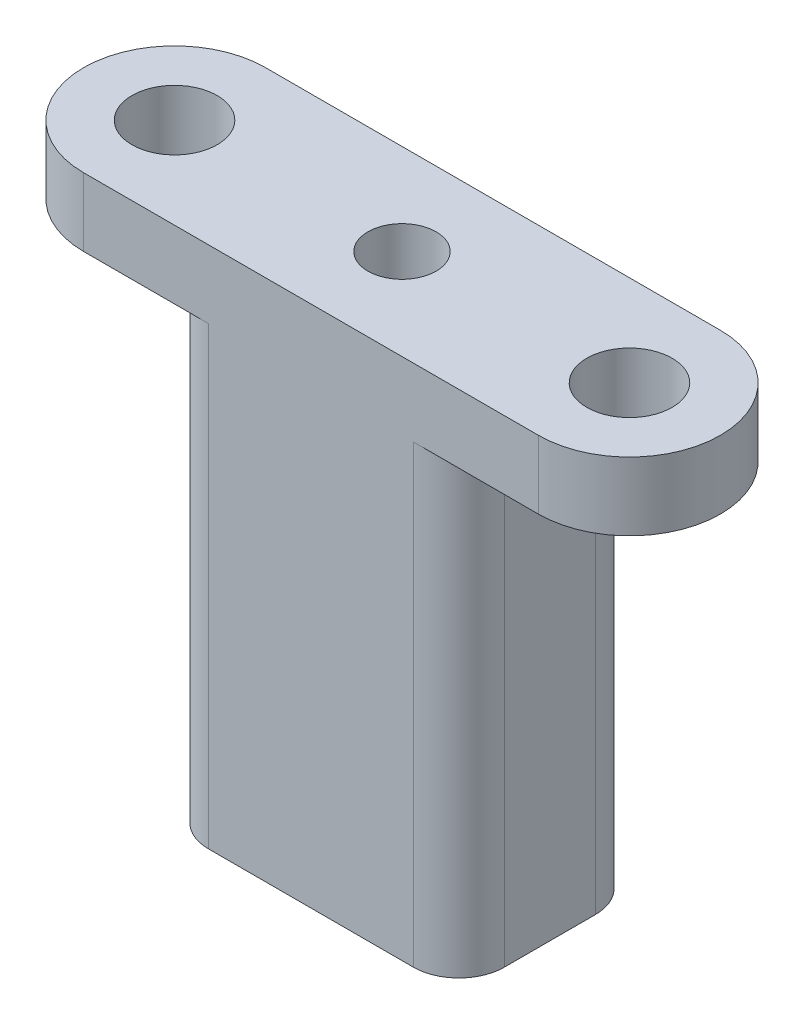
from build123d import *

# Parameters (mm, degrees)
SKETCH1_R           = 1.875
SKETCH1_R_2         = 1.5
BOSS_EXTRUDE1_DEPTH = 3
BOSS_EXTRUDE2_START = 20
SKETCH3_W           = 13
SKETCH3_H           = 8
SKETCH3_R           = 1.5
BOSS_EXTRUDE2_DEPTH = 20
FILLET1_R           = 2


with BuildPart() as part:
    # Sketch1 → Boss-Extrude1 (new body)
    with BuildSketch(Plane(origin=(0, 0, 0), x_dir=(1, 0, 0), z_dir=(0, 1, 0))):
        with BuildLine():
            Line((-10, -4), (10, -4))
            ThreePointArc((10, -4), (14, 0), (10, 4))
            Line((10, 4), (-10, 4))
            ThreePointArc((-10, 4), (-14, 0), (-10, -4))
        make_face()
        with Locations((-10, 0)):
            Circle(SKETCH1_R, mode=Mode.SUBTRACT)
        with Locations((10, 0)):
            Circle(SKETCH1_R, mode=Mode.SUBTRACT)
        Circle(SKETCH1_R_2, mode=Mode.SUBTRACT)
    extrude(amount=BOSS_EXTRUDE1_DEPTH)

    # Sketch3 → Boss-Extrude2 (add)
    with BuildSketch(Plane.XZ.offset(BOSS_EXTRUDE2_START)):
        Rectangle(SKETCH3_W, SKETCH3_H)
        Circle(SKETCH3_R, mode=Mode.SUBTRACT)
    extrude(amount=-BOSS_EXTRUDE2_DEPTH)

    # Fillet1
    fillet1_edges = [part.edges().sort_by_distance(p)[0] for p in [
        (-6.5, -10, 4),
        (6.5, -10, 4),
        (6.5, -10, -4),
        (-6.5, -10, -4),
    ]]
    fillet(fillet1_edges, radius=FILLET1_R)


solid = part.part
